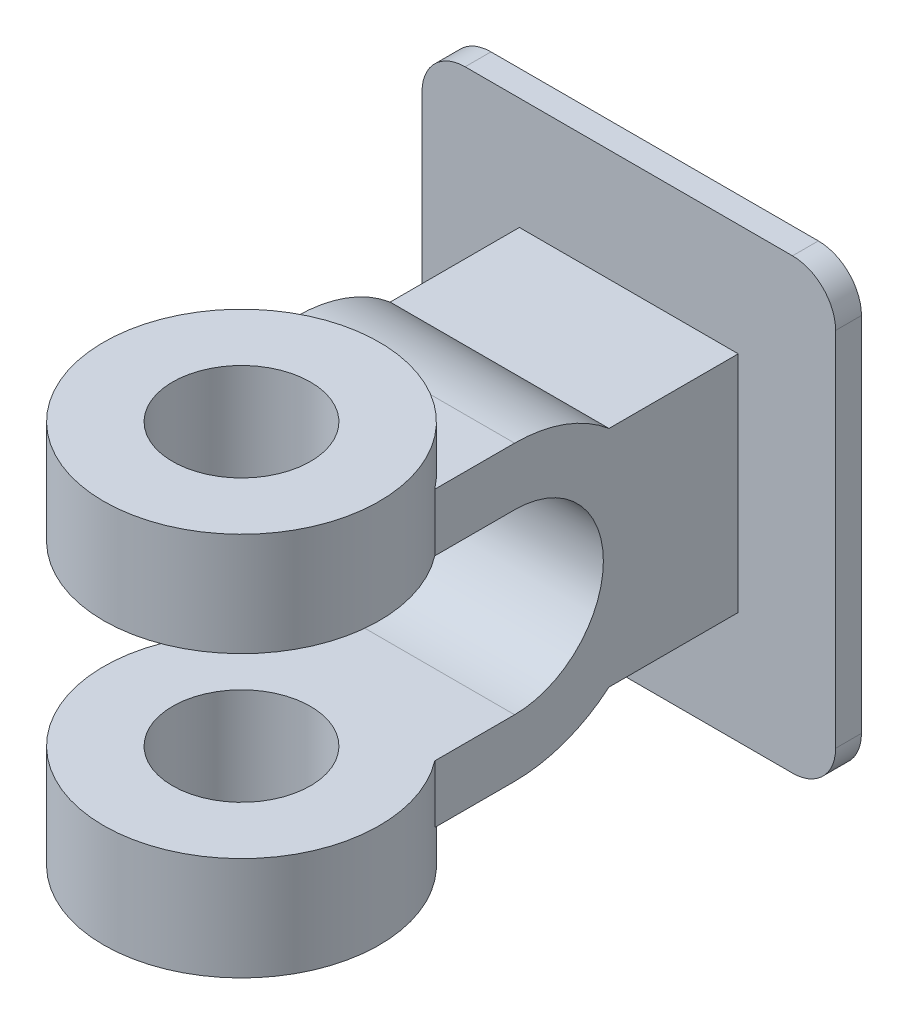
from build123d import *

# Parameters (mm, degrees)
BOSS_EXTRUDE1_DEPTH = 12.7
SKETCH2_R           = 16
BOSS_EXTRUDE2_DEPTH = 12
SKETCH3_R           = 8
CUT_EXTRUDE1_DEPTH  = 26
SKETCH4_W           = 48
SKETCH4_H           = 52
BOSS_EXTRUDE3_DEPTH = 3
FILLET1_R           = 5
SCALE1_SCALE        = 0.7
SCALE2_SCALE        = 0.5
SCALE3_SCALE        = 1.25


with BuildPart() as part:
    # Sketch1 → Boss-Extrude1 (new, symmetric)
    with BuildSketch(Plane(origin=(0, 0, 0), x_dir=(0, 0, -1), z_dir=(1, 0, 0))):
        with BuildLine():
            Line((10.95445115, 13), (25.95445115, 13))
            Line((25.95445115, 13), (25.95445115, -13))
            Line((25.95445115, -13), (10.95445115, -13))
            ThreePointArc((10.95445115, -13), (5.830951895, -15.968719423), (0, -17))
            Line((0, -17), (-19, -17))
            Line((-19, -17), (-19, -10.3))
            Line((-19, -10.3), (0, -10.3))
            ThreePointArc((0, -10.3), (10.3, 0), (0, 10.3))
            Line((0, 10.3), (-19, 10.3))
            Line((-19, 10.3), (-19, 17))
            Line((-19, 17), (0, 17))
            ThreePointArc((0, 17), (5.830951895, 15.968719423), (10.95445115, 13))
        make_face()
    extrude(amount=BOSS_EXTRUDE1_DEPTH, both=True)

    # Sketch2 → Boss-Extrude2 (add)
    with BuildSketch(Plane(origin=(0, -10.3, 0), x_dir=(1, 0, 0), z_dir=(0, 1, 0))):
        with Locations((0, -19)):
            Circle(SKETCH2_R)
    boss_extrude2 = extrude(amount=-BOSS_EXTRUDE2_DEPTH)

    # Sketch3 → Cut-Extrude1 (cut)
    with BuildSketch(Plane(origin=(0, -10.3, 0), x_dir=(1, 0, 0), z_dir=(0, 1, 0))):
        with Locations((0, -19)):
            Circle(SKETCH3_R)
    cut_extrude1 = extrude(amount=-CUT_EXTRUDE1_DEPTH, mode=Mode.SUBTRACT)

    # Mirror2: Boss-Extrude2, Cut-Extrude1 across plane
    add(boss_extrude2.mirror(Plane.ZX))
    add(cut_extrude1.mirror(Plane.ZX), mode=Mode.SUBTRACT)

    # Sketch4 → Boss-Extrude3 (add)
    with BuildSketch(Plane(origin=(0, 0, -25.95445115), x_dir=(-1, 0, 0), z_dir=(0, 0, -1))):
        Rectangle(SKETCH4_W, SKETCH4_H)
    extrude(amount=BOSS_EXTRUDE3_DEPTH)

    # Fillet1
    fillet1_edges = [part.edges().sort_by_distance(p)[0] for p in [
        (-24, -26, -27.45445115),
        (24, -26, -27.45445115),
        (24, 26, -27.45445115),
        (-24, 26, -27.45445115),
    ]]
    fillet(fillet1_edges, radius=FILLET1_R)


with BuildPart() as part_1:
    # Scale1: scaled about (0, 0, -3.538207391)
    add(part.part.scale(SCALE1_SCALE).moved(Location((0, 0, -1.061462217))))


with BuildPart() as part_2:
    # Scale2: scaled about (0, 0, -3.538207391)
    add(part_1.part.scale(SCALE2_SCALE).moved(Location((0, 0, -1.769103695))))


with BuildPart() as part_3:
    # Scale3: scaled about (0, 0, -3.538207391)
    add(part_2.part.scale(SCALE3_SCALE).moved(Location((0, 0, 0.884551848))))


solid = part_3.part
